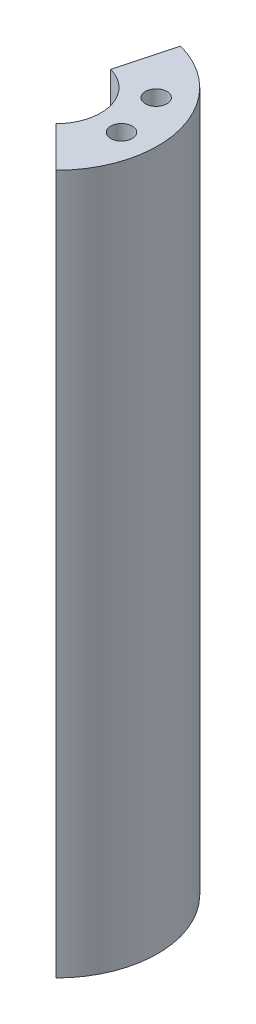
from build123d import *

# Parameters (mm, degrees)
SKETCH1_R           = 1.7
BOSS_EXTRUDE1_DEPTH = 110.3


with BuildPart() as part:
    # Sketch1 → Boss-Extrude1 (new body)
    with BuildSketch(Plane(origin=(0, 0, 0), x_dir=(1, 0, 0), z_dir=(0, 1, 0))):
        with BuildLine():
            Line((4.949747468, -4.949747468), (11.313708499, -11.313708499))
            ThreePointArc((11.313708499, -11.313708499), (15.454813221, 4.141104722), (4.141104722, 15.454813221))
            Line((4.141104722, 15.454813221), (1.811733316, 6.761480784))
            ThreePointArc((1.811733316, 6.761480784), (6.761480784, 1.811733316), (4.949747468, -4.949747468))
        make_face()
        with Locations((11.270656422, -0.986054667)):
            Circle(SKETCH1_R, mode=Mode.SUBTRACT)
        with Locations((9.267647445, 6.489276603)):
            Circle(SKETCH1_R, mode=Mode.SUBTRACT)
    extrude(amount=BOSS_EXTRUDE1_DEPTH)


solid = part.part
